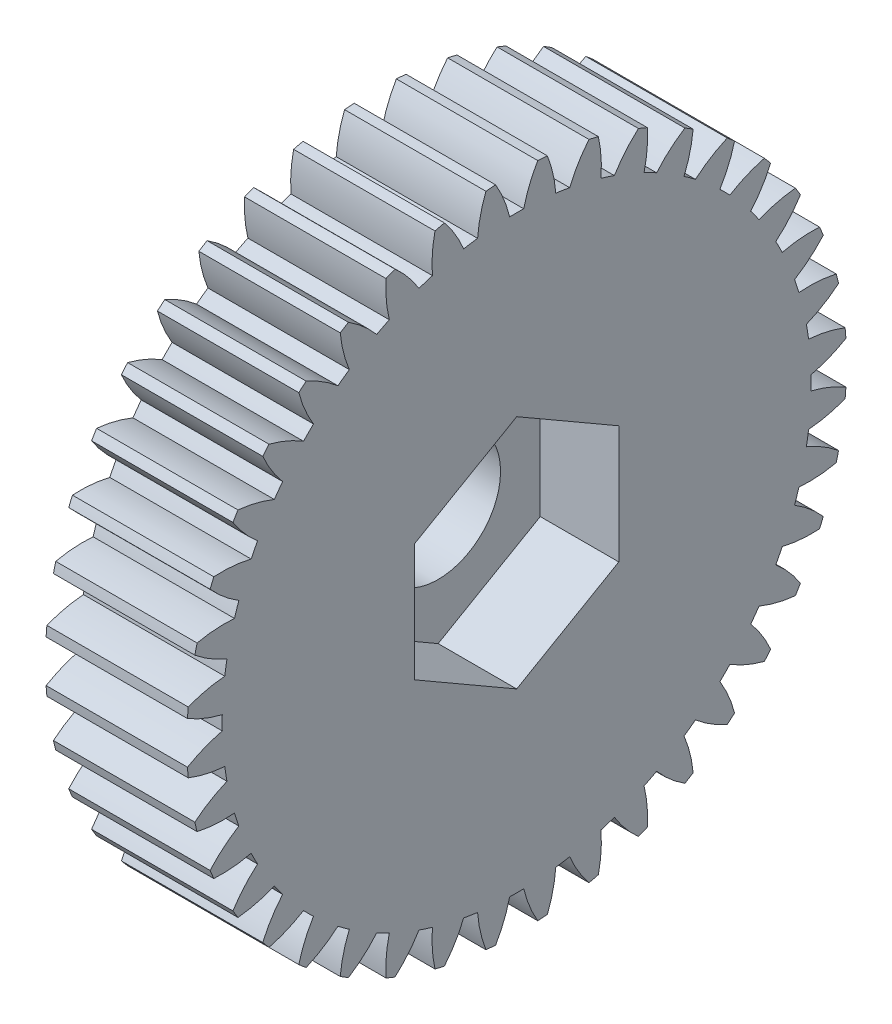
from build123d import *

# Parameters (mm, degrees)
BASPROSKE_W         = 9
BASPROSKE_H         = 21
TOOTHCUT_DEPTH      = 32.032241298
TEETHCUTS_COUNT     = 40
TEETHCUTS_ANGLE     = 351
BORSKE_R            = 2
BORE_DEPTH          = 50.0000508
CUT_EXTRUDE1_DEPTH  = 5
SKETCH1_7_R         = 3.9725
CUT_EXTRUDE2_DEPTH  = 31.974304622
SKETCH2_R           = 6
SKETCH2_R_2         = 4
BOSS_EXTRUDE1_DEPTH = 1.3


with BuildPart() as part:
    # BasProSke → Base-Revolve (revolve)
    with BuildSketch(Plane(origin=(0, 0, 0), x_dir=(1, 0, 0), z_dir=(0, 1, 0))):
        with Locations((4.5, 10.5)):
            Rectangle(BASPROSKE_W, BASPROSKE_H)
    revolve(axis=Axis((-10, 0, 0), (1, 0, 0)))

    # TooCutSke → ToothCut (cut, through all)
    with BuildSketch(Plane(origin=(0, 0, 0), x_dir=(0, 0, -1), z_dir=(1, 0, 0))):
        with BuildLine():
            ThreePointArc((0.448673268, 18.74363074), (0, 18.749), (-0.448673268, 18.74363074))
            ThreePointArc((-0.448673268, 18.74363074), (-0.816786816, 19.89705013), (-1.354745081, 20.981708961))
            ThreePointArc((-1.354745081, 20.981708961), (0, 21.0254), (1.354745081, 20.981708961))
            ThreePointArc((1.354745081, 20.981708961), (0.816786816, 19.89705013), (0.448673268, 18.74363074))
        make_face()
    toothcut = extrude(amount=TOOTHCUT_DEPTH, mode=Mode.SUBTRACT)

    # TeethCuts: ToothCut ×40 about axis
    teethcuts_axis = Axis((-10, 0, 0), (1, 0, 0))
    for i in range(1, TEETHCUTS_COUNT):
        add(toothcut.rotate(teethcuts_axis, i * TEETHCUTS_ANGLE / (TEETHCUTS_COUNT - 1)), mode=Mode.SUBTRACT)

    # BorSke → Bore (cut, symmetric)
    with BuildSketch(Plane(origin=(0, 0, 0), x_dir=(0, 0, -1), z_dir=(1, 0, 0))):
        Circle(BORSKE_R)
    extrude(amount=BORE_DEPTH, both=True, mode=Mode.SUBTRACT)

    # Sketch1 → Cut-Extrude1 (cut)
    with BuildSketch(Plane(origin=(9, 0, 0), x_dir=(0, 0, -1), z_dir=(1, 0, 0))):
        Polygon((0, 7.505553499), (-6.5, 3.75277675), (-6.5, -3.75277675), (0, -7.505553499), (6.5, -3.75277675), (6.5, 3.75277675), align=None)
    extrude(amount=-CUT_EXTRUDE1_DEPTH, mode=Mode.SUBTRACT)

    # Sketch1<7> → Cut-Extrude2 (cut, through all)
    with BuildSketch(Plane(origin=(9, 0, 0), x_dir=(0, 0, -1), z_dir=(1, 0, 0))):
        Circle(SKETCH1_7_R)
    extrude(amount=-CUT_EXTRUDE2_DEPTH, mode=Mode.SUBTRACT)

    # Sketch2 → Boss-Extrude1 (add)
    with BuildSketch(Plane.ZY):
        Circle(SKETCH2_R)
        Circle(SKETCH2_R_2, mode=Mode.SUBTRACT)
    extrude(amount=BOSS_EXTRUDE1_DEPTH)


solid = part.part
